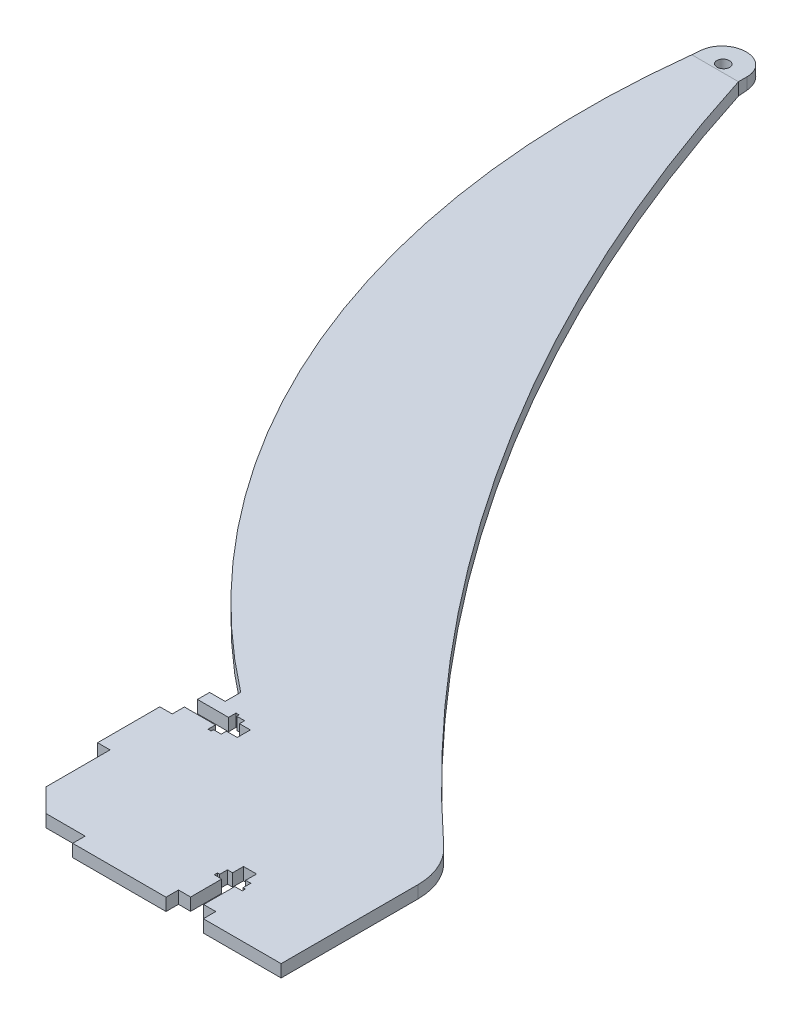
from build123d import *

# Parameters (mm, degrees)
BOSS_EXTRUDE1_DEPTH = 4
SKETCH3_W           = 15
SKETCH3_H           = 4
BOSS_EXTRUDE2_DEPTH = 10
BOSS_EXTRUDE2_TAPER = 2.5
FILLET1_R           = 7.378514
SKETCH4_R           = 2
CUT_EXTRUDE1_DEPTH  = 341.626738097
CUT_EXTRUDE2_DEPTH  = 10
CHAMFER1_SIZE       = 7.5


with BuildPart() as part:
    # Sketch1 → Boss-Extrude1 (new body)
    with BuildSketch(Plane(origin=(0, 0, 0), x_dir=(1, 0, 0), z_dir=(0, 1, 0))):
        with BuildLine():
            Line((87, 0), (87, -4))
            Line((87, -4), (62, -4))
            Line((62, -4), (62, 0))
            Line((62, 0), (50, 0))
            Line((50, 0), (50, -4))
            Line((50, -4), (20, -4))
            Line((20, -4), (20, 0))
            Line((20, 0), (0, 0))
            Line((0, 0), (0, 28))
            Line((0, 28), (-4, 28))
            Line((-4, 28), (-4, 48))
            Line((-4, 48), (0, 48))
            Line((0, 48), (0, 60))
            Line((0, 60), (5, 60))
            Line((5, 60), (5, 65))
            ThreePointArc((5, 65), (-80.454718631, 176.159018175), (-100, 315))
            Line((-100, 315), (-85, 315))
            ThreePointArc((-85, 315), (-19.238758626, 174.034445441), (80.549564864, 54.710856263))
            ThreePointArc((80.549564864, 54.710856263), (85.316540302, 48.031460101), (87, 40))
            Line((87, 40), (87, 0))
        make_face()
    extrude(amount=BOSS_EXTRUDE1_DEPTH)

    # Sketch3 → Boss-Extrude2 (add)
    with BuildSketch(Plane(origin=(0, 0, -315), x_dir=(-1, 0, 0), z_dir=(0, 0, -1))):
        with Locations((92.5, 2)):
            Rectangle(SKETCH3_W, SKETCH3_H)
    extrude(amount=BOSS_EXTRUDE2_DEPTH, taper=BOSS_EXTRUDE2_TAPER)

    # Fillet1
    fillet1_edges = [part.edges().sort_by_distance(p)[0] for p in [
        (-85.436609429, 2, -325),
        (-99.563390571, 2, -325),
    ]]
    fillet(fillet1_edges, radius=FILLET1_R - 0.0001)  # a hair under: the kernel refuses the full size

    # Sketch4 → Cut-Extrude1 (cut, through all)
    with BuildSketch(Plane(origin=(0, 4, 0), x_dir=(1, 0, 0), z_dir=(0, 1, 0))):
        with Locations(Location((-92.5, 317.621485949, 0), (0, 0, 270))):
            Circle(SKETCH4_R)
    extrude(amount=-CUT_EXTRUDE1_DEPTH, mode=Mode.SUBTRACT)

    # Sketch5 → Cut-Extrude2 (cut)
    with BuildSketch(Plane(origin=(0, 4, 0), x_dir=(1, 0, 0), z_dir=(0, 1, 0))):
        Polygon((53.9, 10), (53.9, 0), (58.1, 0), (58.1, 10), (60.5, 10), (60.5, 11), (59.75, 11), (59.75, 13.5), (58.1, 13.5), (58.1, 17), (53.9, 17), (53.9, 13.5), (52.25, 13.5), (52.25, 11), (51.5, 11), (51.5, 10), align=None)
        Polygon((10, 56.1), (0, 56.1), (0, 51.9), (10, 51.9), (10, 49.5), (11, 49.5), (11, 50.25), (13.5, 50.25), (13.5, 51.9), (17, 51.9), (17, 56.1), (13.5, 56.1), (13.5, 57.75), (11, 57.75), (11, 58.5), (10, 58.5), align=None)
    extrude(amount=-CUT_EXTRUDE2_DEPTH, mode=Mode.SUBTRACT)

    # Chamfer1
    chamfer1_edges = [part.edges().sort_by_distance(p)[0] for p in [
        (0, 2, 0),
    ]]
    chamfer(chamfer1_edges, length=CHAMFER1_SIZE)


solid = part.part
